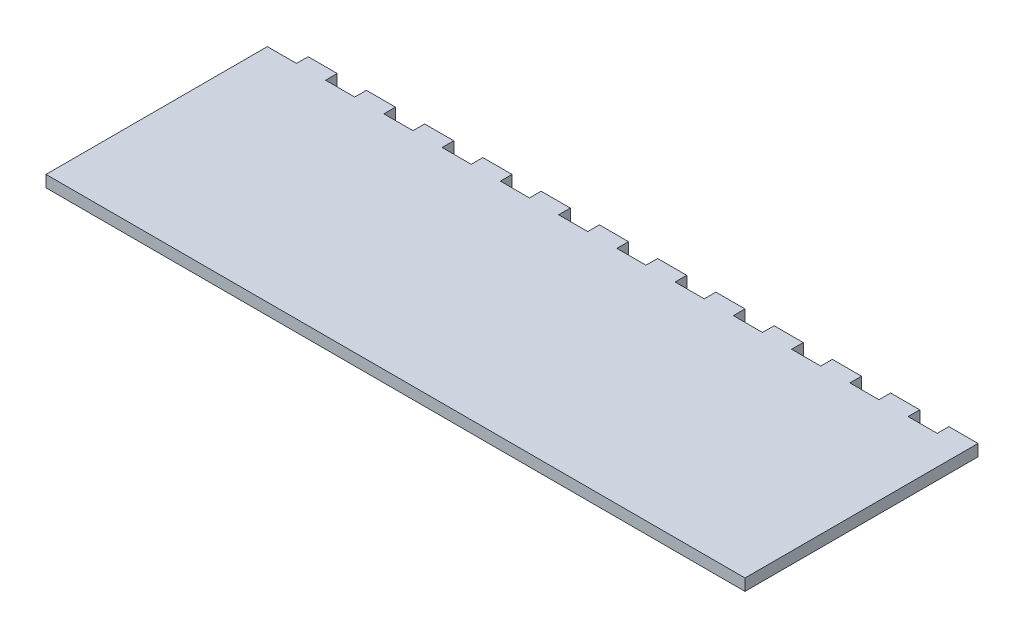
from build123d import *

# Parameters (mm, degrees)
SKETCH1_W           = 152.4
SKETCH1_H           = 50.8
BOSS_EXTRUDE1_DEPTH = 2.54
SKETCH2_W           = 6.35
SKETCH2_H           = 2.54
CUT_EXTRUDE1_DEPTH  = 2.54


with BuildPart() as part:
    # Sketch1 → Boss-Extrude1 (new body)
    with BuildSketch(Plane(origin=(0, 0, 0), x_dir=(1, 0, 0), z_dir=(0, 1, 0))):
        Rectangle(SKETCH1_W, SKETCH1_H)
    extrude(amount=BOSS_EXTRUDE1_DEPTH)

    # Sketch2 → Cut-Extrude1 (cut)
    with BuildSketch(Plane(origin=(0, 2.54, 0), x_dir=(1, 0, 0), z_dir=(0, 1, 0))):
        with Locations((-73.025, 24.13)):
            Rectangle(SKETCH2_W, SKETCH2_H)
        with Locations((66.675, 24.13)):
            Rectangle(SKETCH2_W, SKETCH2_H)
        with Locations((53.975, 24.13)):
            Rectangle(SKETCH2_W, SKETCH2_H)
        with Locations((41.275, 24.13)):
            Rectangle(SKETCH2_W, SKETCH2_H)
        with Locations((28.575, 24.13)):
            Rectangle(SKETCH2_W, SKETCH2_H)
        with Locations((15.875, 24.13)):
            Rectangle(SKETCH2_W, SKETCH2_H)
        with Locations((3.175, 24.13)):
            Rectangle(SKETCH2_W, SKETCH2_H)
        with Locations((-9.525, 24.13)):
            Rectangle(SKETCH2_W, SKETCH2_H)
        with Locations((-22.225, 24.13)):
            Rectangle(SKETCH2_W, SKETCH2_H)
        with Locations((-34.925, 24.13)):
            Rectangle(SKETCH2_W, SKETCH2_H)
        with Locations((-47.625, 24.13)):
            Rectangle(SKETCH2_W, SKETCH2_H)
        with Locations((-60.325, 24.13)):
            Rectangle(SKETCH2_W, SKETCH2_H)
    extrude(amount=-CUT_EXTRUDE1_DEPTH, mode=Mode.SUBTRACT)


solid = part.part
